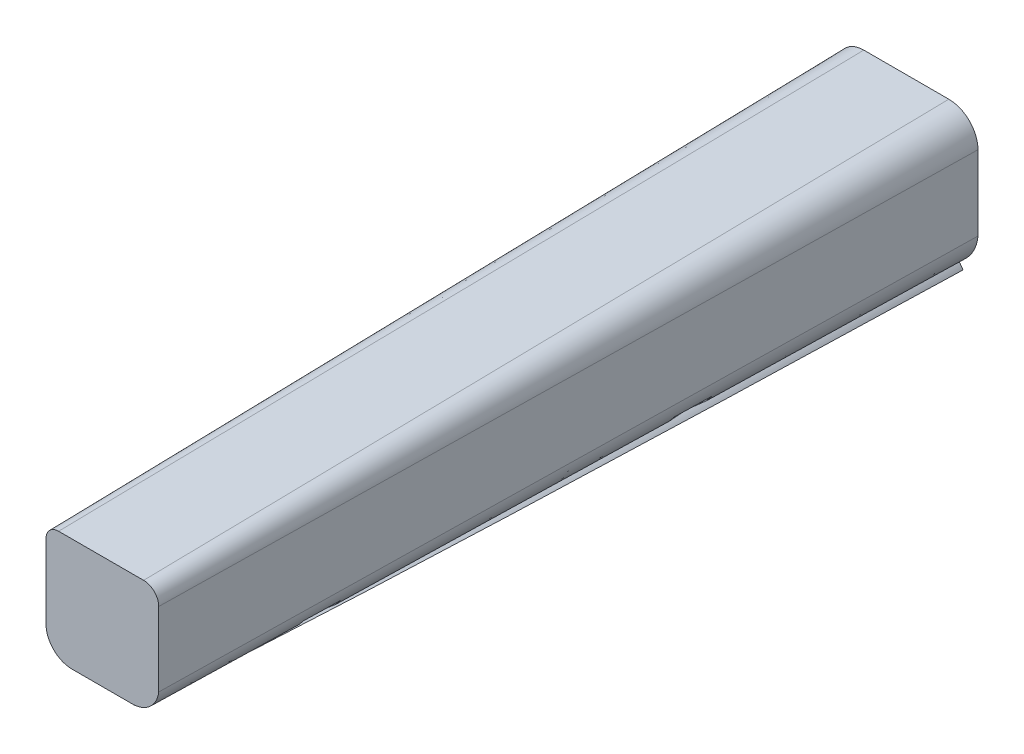
from build123d import *

# Parameters (mm, degrees)
BOSS_EXTRUDE2_DEPTH = 500
CUT_EXTRUDE1_DEPTH  = 500
CUT_EXTRUDE4_DEPTH  = 500
CUT_EXTRUDE5_DEPTH  = 500
CUT_EXTRUDE9_DEPTH  = 500
DRAFT1_ANGLE        = 1.0000000000000022


with BuildPart() as part:
    # Sketch3 → Boss-Extrude2 (new body)
    with BuildSketch(Plane.XY):
        Polygon((-35, 35), (35, 35), (35.000000000000014, -35), (-34.99999999999999, -35), align=None)
    extrude(amount=BOSS_EXTRUDE2_DEPTH)

    # Sketch5 → Cut-Extrude1 (cut)
    with BuildSketch(Plane.XY.offset(500)):
        with BuildLine():
            ThreePointArc((-27.175362611158825, 35), (-32.70821676913422, 32.70821676913422), (-35, 27.175362611158825))
            ThreePointArc((-35, 27.175362611158825), (-50.905444511250046, 31.341175288232527), (-46.47422593438686, 47.174730236031984))
            ThreePointArc((-46.47422593438686, 47.174730236031984), (-34.25023671279524, 45.1684440006299), (-27.175362611158825, 35))
        make_face()
    extrude(amount=-CUT_EXTRUDE1_DEPTH, mode=Mode.SUBTRACT)

    # Sketch6 → Cut-Extrude4 (cut)
    with BuildSketch(Plane.XY.offset(500)):
        with BuildLine():
            ThreePointArc((35, 25.617969734713974), (32.252066956595144, 32.252066956595144), (25.617969734713974, 35))
            ThreePointArc((25.617969734713974, 35), (34.89084510067966, 40.434054533773164), (45.56758527381377, 39.200204662784735))
            ThreePointArc((45.56758527381377, 39.200204662784735), (48.60167705204541, 25.937401697783834), (35, 25.617969734713974))
        make_face()
    extrude(amount=-CUT_EXTRUDE4_DEPTH, mode=Mode.SUBTRACT)

    # Sketch8 → Cut-Extrude5 (cut)
    with BuildSketch(Plane.XY.offset(500)):
        with BuildLine():
            ThreePointArc((-34.99999999999999, -18.853089498248828), (-30.270679409249354, -30.27067940924936), (-18.85308949824882, -35))
            ThreePointArc((-18.85308949824882, -35), (-20.01674687799842, -57.77403934974639), (-40.84786715107791, -48.496356720461264))
            ThreePointArc((-40.84786715107791, -48.496356720461264), (-53.63479768324401, -40.47163298838024), (-57.00218640499699, -25.755571130421206))
            ThreePointArc((-57.00218640499699, -25.755571130421206), (-49.452334018584686, -11.303237111836514), (-34.99999999999999, -18.853089498248828))
        make_face()
    extrude(amount=-CUT_EXTRUDE5_DEPTH, mode=Mode.SUBTRACT)

    # Sketch9 → Cut-Extrude9 (cut)
    with BuildSketch(Plane.XY.offset(500)):
        with BuildLine():
            ThreePointArc((19.57483747437183, -34.96977032497742), (31.324770360147028, -39.709080157873096), (36.48275919973315, -51.28133713925353))
            ThreePointArc((36.48275919973315, -51.28133713925353), (52.58382868627743, -57.284851607828145), (60.900632494866514, -42.24765110393281))
            ThreePointArc((60.900632494866514, -42.24765110393281), (55.59397285541981, -21.700647013345936), (35.000000000000014, -16.57929019529863))
            ThreePointArc((35.00000000000003, -16.579290195298633), (31.242390348966733, -29.091794380801865), (19.57483747437183, -34.96977032497743))
        make_face()
    extrude(amount=-CUT_EXTRUDE9_DEPTH, mode=Mode.SUBTRACT)

    # Draft1
    draft1_faces = [part.faces().sort_by_distance(p)[0] for p in [
        (0.8718604650214657, -35, 250.00000000000003),
        (-30.270679409249354, -30.27067940924936, 250),
        (-32.70821676913422, 32.70821676913422, 250),
        (-0.7786964382224253, 35, 250),
        (-35, 4.1611365564549985, 250),
        (29.946183881655344, -30.468868285551533, 250),
        (32.252066956595144, 32.252066956595144, 250),
        (35.00000000000001, 2.6312761499512045, 249.99999999999997),
    ]]
    draft(draft1_faces, Plane.XY.offset(500), DRAFT1_ANGLE)


solid = part.part
